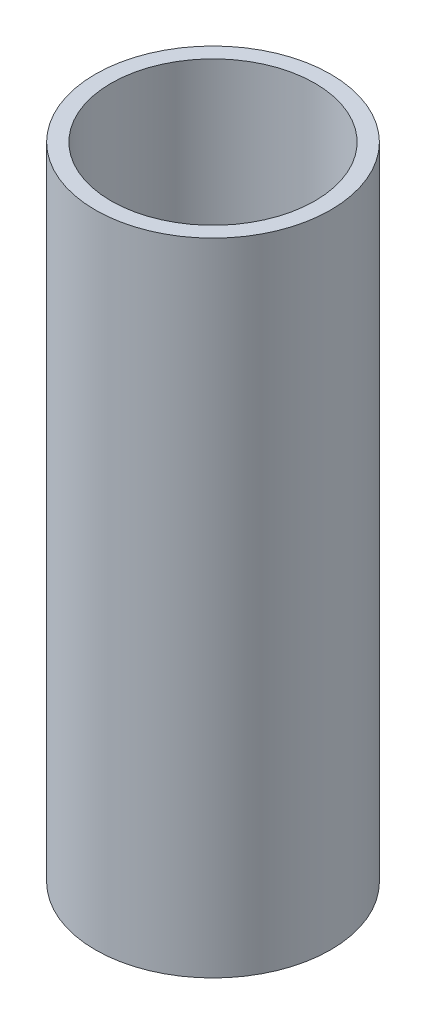
from build123d import *

# Parameters (mm, degrees)
SKETCH1_R           = 40
BOSS_EXTRUDE1_DEPTH = 217.809320949
SKETCH2_R           = 34.652156843
CUT_EXTRUDE1_DEPTH  = 226.035331208


with BuildPart() as part:
    # Sketch1 → Boss-Extrude1 (new body)
    with BuildSketch(Plane(origin=(0, 0, 0), x_dir=(1, 0, 0), z_dir=(0, 1, 0))):
        Circle(SKETCH1_R)
    extrude(amount=BOSS_EXTRUDE1_DEPTH)

    # Sketch2 → Cut-Extrude1 (cut, through all)
    with BuildSketch(Plane(origin=(0, 0, 0), x_dir=(1, 0, 0), z_dir=(0, 1, 0))):
        Circle(SKETCH2_R)
    extrude(amount=CUT_EXTRUDE1_DEPTH, mode=Mode.SUBTRACT)


solid = part.part
